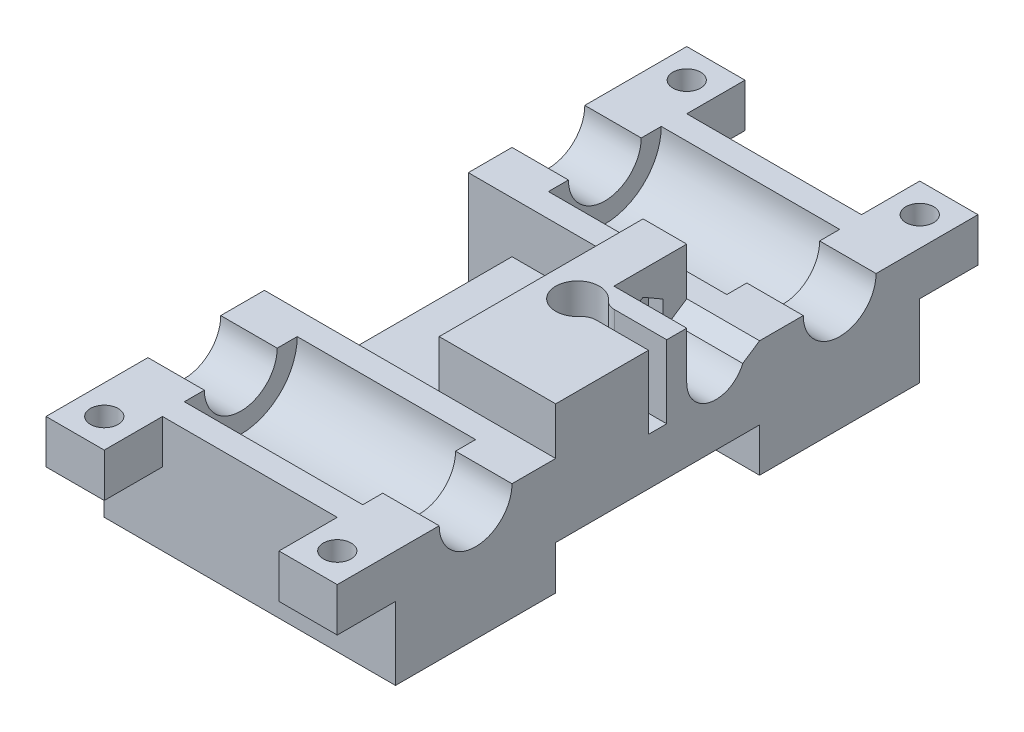
from build123d import *

# Parameters (mm, degrees)
SKETCH1_W                  = 40
SKETCH1_H                  = 22
BOSS_EXTRUDE1_DEPTH        = 11
SKETCH2_W                  = 40
SKETCH2_H                  = 22
SKETCH2_R                  = 7.843750423
BOSS_EXTRUDE2_DEPTH        = 5
SKETCH3_W                  = 24.5
SKETCH3_H                  = 15.5
CUT_EXTRUDE1_DEPTH         = 7.75
FILLET1_R                  = 7.75
SKETCH4_R                  = 5
CUT_EXTRUDE2_DEPTH         = 36.805900352
SKETCH5_W                  = 8
SKETCH5_H                  = 8
SKETCH5_R                  = 1.905800151
BOSS_EXTRUDE3_DEPTH        = 6
CUT_EXTRUDE3_START         = -3
SKETCH6_R                  = 3
SKETCH6_R_2                = 1.905800151
CUT_EXTRUDE3_DEPTH         = 3
SKETCH7_W                  = 16
SKETCH7_H                  = 16.5
BOSS_EXTRUDE5_DEPTH        = 28
MIRROR14_COPY_1_SKETCH_W   = 8
MIRROR14_COPY_1_SKETCH_H   = 8
MIRROR14_COPY_1_SKETCH_R   = 1.905800151
MIRROR14_COPY_1_DEPTH      = 6
MIRROR14_START             = -3
MIRROR14_COPY_2_SKETCH_R   = 3
MIRROR14_COPY_2_SKETCH_R_2 = 1.905800151
MIRROR14_COPY_2_DEPTH      = 3
FILLET1_OF_MIRROR14_R      = 7.75
SKETCH9_W                  = 28
SKETCH9_H                  = 3
BOSS_EXTRUDE6_DEPTH        = 18
CUT_EXTRUDE4_DEPTH         = 10
CUT_EXTRUDE5_DEPTH         = 73.919476136
CUT_EXTRUDE5_DEPTH_BACK    = 73.919476136
SKETCH11_R                 = 1.75
CUT_EXTRUDE6_DEPTH         = 76.121568141
CUT_EXTRUDE6_DEPTH_BACK    = 76.121568141
SKETCH12_R                 = 1.75
CUT_EXTRUDE9_DEPTH         = 12
CUT_EXTRUDE11_START        = -10
SKETCH16_R                 = 4
SKETCH16_R_2               = 1.75
SKETCH16_W                 = 10
SKETCH16_H                 = 6.5
CUT_EXTRUDE11_DEPTH        = 10
FILLET2_R                  = 2
CUT_EXTRUDE12_START        = -3
SKETCH17_R                 = 1.75
CUT_EXTRUDE12_DEPTH        = 3


# Some blends are built 0.0001 mm under size
with BuildPart() as part:
    # Sketch1 → Boss-Extrude1 (new body)
    with BuildSketch(Plane(origin=(0, 0, 0), x_dir=(1, 0, 0), z_dir=(0, 1, 0))):
        Rectangle(SKETCH1_W, SKETCH1_H)
    boss_extrude1 = extrude(amount=BOSS_EXTRUDE1_DEPTH)

    # Sketch2 → Boss-Extrude2 (add)
    with BuildSketch(Plane(origin=(0, 0, 0), x_dir=(1, 0, 0), z_dir=(0, 1, 0))):
        Rectangle(SKETCH2_W, SKETCH2_H)
        with Locations(Location((0, 0, 0), (0, 0, 270))):
            Circle(SKETCH2_R, mode=Mode.SUBTRACT)
    boss_extrude2 = extrude(amount=-BOSS_EXTRUDE2_DEPTH)

    # Sketch3 → Cut-Extrude1 (cut)
    with BuildSketch(Plane(origin=(0, 11, 0), x_dir=(1, 0, 0), z_dir=(0, 1, 0))):
        Rectangle(SKETCH3_W, SKETCH3_H)
    cut_extrude1 = extrude(amount=-CUT_EXTRUDE1_DEPTH, mode=Mode.SUBTRACT)

    # Fillet1
    fillet1_edges = [part.edges().sort_by_distance(p)[0] for p in [
        (0, 3.25, 7.75),
        (0, 3.25, -7.75),
    ]]
    fillet(fillet1_edges, radius=FILLET1_R - 0.0001)  # a hair under: the kernel refuses the full size

    # Sketch4 → Cut-Extrude2 (cut, symmetric)
    with BuildSketch(Plane(origin=(-12.25, 0, 0), x_dir=(0, 0, -1), z_dir=(1, 0, 0))):
        with Locations((0, 11)):
            Circle(SKETCH4_R)
    cut_extrude2 = extrude(amount=CUT_EXTRUDE2_DEPTH, both=True, mode=Mode.SUBTRACT)

    # Sketch5 → Boss-Extrude3 (add)
    with BuildSketch(Plane(origin=(0, 11, 0), x_dir=(1, 0, 0), z_dir=(0, 1, 0))):
        with Locations((16, -15)):
            Rectangle(SKETCH5_W, SKETCH5_H)
        with Locations(Location((16, -15, 0), (0, 0, 270))):
            Circle(SKETCH5_R, mode=Mode.SUBTRACT)
    boss_extrude3 = extrude(amount=-BOSS_EXTRUDE3_DEPTH)

    # Sketch6 → Cut-Extrude3 (cut)
    with BuildSketch(Plane.XZ.offset(-5).offset(CUT_EXTRUDE3_START)):
        with Locations(Location((16, 15, 0), (0, 0, 270))):
            Circle(SKETCH6_R)
        with Locations(Location((16, 15, 0), (0, 0, 90))):
            Circle(SKETCH6_R_2, mode=Mode.SUBTRACT)
    cut_extrude3 = extrude(amount=CUT_EXTRUDE3_DEPTH, mode=Mode.SUBTRACT)

    # Mirror8: Boss-Extrude3, Cut-Extrude3 across plane
    add(boss_extrude3.mirror(Plane(origin=(0, 0, 0), x_dir=(0, 0, 1), z_dir=(1, 0, 0))))
    add(cut_extrude3.mirror(Plane(origin=(0, 0, 0), x_dir=(0, 0, 1), z_dir=(1, 0, 0))), mode=Mode.SUBTRACT)

    # Sketch7 → Boss-Extrude5 (add)
    with BuildSketch(Plane(origin=(0, 0, -11), x_dir=(-1, 0, 0), z_dir=(0, 0, -1))):
        with Locations((-12, 9.25)):
            Rectangle(SKETCH7_W, SKETCH7_H)
    extrude(amount=BOSS_EXTRUDE5_DEPTH)

    # Mirror14: Boss-Extrude1, Boss-Extrude2, Cut-Extrude1, Cut-Extrude2, Boss-Extrude3, Cut-Extrude3 across plane
    add(boss_extrude1.mirror(Plane.XY.offset(-25)))
    add(boss_extrude2.mirror(Plane.XY.offset(-25)))
    add(cut_extrude1.mirror(Plane.XY.offset(-25)), mode=Mode.SUBTRACT)
    add(cut_extrude2.mirror(Plane.XY.offset(-25)), mode=Mode.SUBTRACT)
    add(boss_extrude3.mirror(Plane.XY.offset(-25)))
    add(cut_extrude3.mirror(Plane.XY.offset(-25)), mode=Mode.SUBTRACT)

    # Mirror14 copy 1 sketch → Mirror14 copy 1 (add)
    with BuildSketch(Plane(origin=(0, 11, -50), x_dir=(-1, 0, 0), z_dir=(0, 1, 0))):
        with Locations((16, -15)):
            Rectangle(MIRROR14_COPY_1_SKETCH_W, MIRROR14_COPY_1_SKETCH_H)
        with Locations(Location((16, -15, 0), (0, 0, 270))):
            Circle(MIRROR14_COPY_1_SKETCH_R, mode=Mode.SUBTRACT)
    extrude(amount=-MIRROR14_COPY_1_DEPTH)

    # Mirror14 copy 2 sketch → Mirror14 copy 2 (cut)
    with BuildSketch(Plane(origin=(0, 5, -50), x_dir=(-1, 0, 0), z_dir=(0, -1, 0)).offset(MIRROR14_START)):
        with Locations(Location((16, 15, 0), (0, 0, 270))):
            Circle(MIRROR14_COPY_2_SKETCH_R)
        with Locations(Location((16, 15, 0), (0, 0, 90))):
            Circle(MIRROR14_COPY_2_SKETCH_R_2, mode=Mode.SUBTRACT)
    extrude(amount=MIRROR14_COPY_2_DEPTH, mode=Mode.SUBTRACT)

    # Fillet1 of Mirror14
    fillet1_of_mirror14_edges = [part.edges().sort_by_distance(p)[0] for p in [
        (0, 3.25, -57.75),
        (0, 3.25, -42.25),
    ]]
    fillet(fillet1_of_mirror14_edges, radius=FILLET1_OF_MIRROR14_R - 0.0001)  # a hair under: the kernel refuses the full size

    # Sketch9 → Boss-Extrude6 (add)
    with BuildSketch(Plane.ZY.offset(-4)):
        with Locations((-25, 2.5)):
            Rectangle(SKETCH9_W, SKETCH9_H)
    extrude(amount=BOSS_EXTRUDE6_DEPTH)

    # Sketch10 → Cut-Extrude4 (cut)
    with BuildSketch(Plane(origin=(0, 17.5, 0), x_dir=(1, 0, 0), z_dir=(0, 1, 0))):
        with BuildLine():
            Line((9, 26.25), (9, 23.75))
            Line((9, 23.75), (11.727178029, 23.75))
            ThreePointArc((11.727178029, 23.75), (11.931001031, 24.360286817), (12, 25))
            ThreePointArc((12, 25), (11.931001031, 25.639713183), (11.727178029, 26.25))
            Line((11.727178029, 26.25), (9, 26.25))
        make_face()
        with BuildLine():
            Line((11.727178029, 23.75), (9, 23.75))
            Line((9, 23.75), (9, 26.25))
            Line((9, 26.25), (11.727178029, 26.25))
            ThreePointArc((11.727178029, 26.25), (6, 25), (11.727178029, 23.75))
        make_face()
        with BuildLine():
            ThreePointArc((12, 25), (11.931001031, 24.360286817), (11.727178029, 23.75))
            Line((11.727178029, 23.75), (20, 23.75))
            Line((20, 23.75), (20, 26.25))
            Line((20, 26.25), (11.727178029, 26.25))
            ThreePointArc((11.727178029, 26.25), (11.931001031, 25.639713183), (12, 25))
        make_face()
    extrude(amount=-CUT_EXTRUDE4_DEPTH, mode=Mode.SUBTRACT)

    # Sketch11 → Cut-Extrude5 (cut, two sides: drawn at the far end of the back side and taken through both)
    with BuildSketch(Plane(origin=(0, 7.5, 0), x_dir=(1, 0, 0), z_dir=(0, 1, 0)).offset(-CUT_EXTRUDE5_DEPTH_BACK)):
        with Locations(Location((9, 25, 0), (0, 0, 270))):
            Circle(SKETCH11_R)
    extrude(amount=CUT_EXTRUDE5_DEPTH + CUT_EXTRUDE5_DEPTH_BACK, mode=Mode.SUBTRACT)

    # Sketch12 → Cut-Extrude6 (cut, two sides: drawn at the far end of the back side and taken through both)
    with BuildSketch(Plane.ZY.offset(-4).offset(-CUT_EXTRUDE6_DEPTH_BACK)):
        with Locations((-33, 11)):
            Circle(SKETCH12_R)
    extrude(amount=CUT_EXTRUDE6_DEPTH + CUT_EXTRUDE6_DEPTH_BACK, mode=Mode.SUBTRACT)

    # Sketch15 → Cut-Extrude9 (cut)
    with BuildSketch(Plane(origin=(20, 0, 0), x_dir=(0, 0, -1), z_dir=(1, 0, 0))):
        Polygon((33, 14.175426481), (30.25, 12.58771324), (30.25, 9.41228676), (33, 7.824573519), (35.75, 9.41228676), (35.75, 12.58771324), align=None)
    extrude(amount=-CUT_EXTRUDE9_DEPTH, mode=Mode.SUBTRACT)

    # Sketch16 → Cut-Extrude11 (cut)
    # profile 1 of 2: a face of its own
    with BuildSketch(Plane(origin=(20, 0, 0), x_dir=(0, 0, -1), z_dir=(1, 0, 0)).offset(CUT_EXTRUDE11_START)):
        with Locations((33, 11)):
            Circle(SKETCH16_R)
        with Locations((33, 11)):
            Circle(SKETCH16_R_2, mode=Mode.SUBTRACT)
    # profile 2 of 2: a face of its own
    with BuildSketch(Plane(origin=(20, 0, 0), x_dir=(0, 0, -1), z_dir=(1, 0, 0)).offset(CUT_EXTRUDE11_START)):
        with Locations((34, 14.25)):
            Rectangle(SKETCH16_W, SKETCH16_H)
    extrude(amount=CUT_EXTRUDE11_DEPTH, mode=Mode.SUBTRACT)

    # Chamfer3
    # the kernel refuses this chamfer: 2.5 mm, written as the material it takes off along each edge
    with BuildSketch(Plane(origin=(4.790141486, 11, -37), x_dir=(0, -0.9712202897009368, 0.23818301550116588), z_dir=(1, 0, 0))) as chamfer3_piece_1_section:
        with BuildLine():
            Line((1.641163776, 0), (-0.550057664, 2.010038976))
            Line((-0.550057664, 2.010038976), (-0.598618679, 1.998129825))
            ThreePointArc((-0.598618679, 1.998129825), (-0.296653042, 0.999716345), (-0.048561014, -0.011909151))
            Line((-0.048561014, -0.011909151), (0.011909151, -0.048561014))
            ThreePointArc((0.011909151, -0.048561014), (0.818444442, 0.062835502), (1.633479525, -0.049405994))
            Line((1.633479525, -0.049405994), (1.641163776, 0))
        make_face()
    chamfer3_piece_1 = extrude(amount=20.419717028, mode=Mode.PRIVATE)
    chamfer3_piece_1 = split(chamfer3_piece_1, bisect_by=Plane(origin=(10, 11.063270064, -39.03704072), z_dir=(-1, 0, 0)), keep=Keep.TOP, mode=Mode.PRIVATE)
    chamfer3_piece_1 = split(chamfer3_piece_1, bisect_by=Plane(origin=(7.395070743, 11.063270064, -39), z_dir=(0, 0, -1)), keep=Keep.TOP, mode=Mode.PRIVATE)
    add(chamfer3_piece_1, mode=Mode.SUBTRACT)
    with BuildSketch(Plane(origin=(10, 11, -37), x_dir=(0, -0.9712202897009377, 0.23818301550116178), z_dir=(1, 0, 0))) as chamfer3_piece_2_section:
        with BuildLine():
            Line((1.641163776, 0), (-0.550057664, 2.010038976))
            Line((-0.550057664, 2.010038976), (-0.598618679, 1.998129825))
            ThreePointArc((-0.598618679, 1.998129825), (-0.296653042, 0.999716345), (-0.048561014, -0.011909151))
            Line((-0.048561014, -0.011909151), (0.011909151, -0.048561014))
            ThreePointArc((0.011909151, -0.048561014), (0.818444442, 0.062835502), (1.633479525, -0.049405994))
            Line((1.633479525, -0.049405994), (1.641163776, 0))
        make_face()
    chamfer3_piece_2 = extrude(amount=15.209858514, mode=Mode.PRIVATE)
    chamfer3_piece_2 = split(chamfer3_piece_2, bisect_by=Plane(origin=(17.604929257, 10.514615405, -39), z_dir=(0, 0, 1)), keep=Keep.TOP, mode=Mode.PRIVATE)
    add(chamfer3_piece_2, mode=Mode.SUBTRACT)
    with BuildSketch(Plane(origin=(10, 11, -37), x_dir=(0, -0.9712202897009377, 0.23818301550116178), z_dir=(1, 0, 0))) as chamfer3_piece_3_section:
        with BuildLine():
            Line((1.641163776, 0), (-0.550057664, 2.010038976))
            Line((-0.550057664, 2.010038976), (-0.598618679, 1.998129825))
            ThreePointArc((-0.598618679, 1.998129825), (-0.296653042, 0.999716345), (-0.048561014, -0.011909151))
            Line((-0.048561014, -0.011909151), (0.011909151, -0.048561014))
            ThreePointArc((0.011909151, -0.048561014), (0.818444442, 0.062835502), (1.633479525, -0.049405994))
            Line((1.633479525, -0.049405994), (1.641163776, 0))
        make_face()
    chamfer3_piece_3 = extrude(amount=15.209858514, mode=Mode.PRIVATE)
    chamfer3_piece_3 = split(chamfer3_piece_3, bisect_by=Plane(origin=(17.604929257, 11.063270064, -39), z_dir=(0, 0, -1)), keep=Keep.TOP, mode=Mode.PRIVATE)
    add(chamfer3_piece_3, mode=Mode.SUBTRACT)

    # Fillet2
    fillet2_edges = [part.edges().sort_by_distance(p)[0] for p in [
        (11.727178029, 12.5, -23.75),
        (11.727178029, 12.5, -26.25),
    ]]
    fillet(fillet2_edges, radius=FILLET2_R)

    # Sketch17 → Cut-Extrude12 (cut)
    with BuildSketch(Plane.XZ.offset(-1).offset(CUT_EXTRUDE12_START)):
        Polygon((12.175426481, -25), (10.58771324, -22.25), (7.41228676, -22.25), (5.824573519, -25), (7.41228676, -27.75), (10.58771324, -27.75), align=None)
        with Locations(Location((9, -25, 0), (0, 0, 90))):
            Circle(SKETCH17_R, mode=Mode.SUBTRACT)
    extrude(amount=CUT_EXTRUDE12_DEPTH, mode=Mode.SUBTRACT)


solid = part.part
